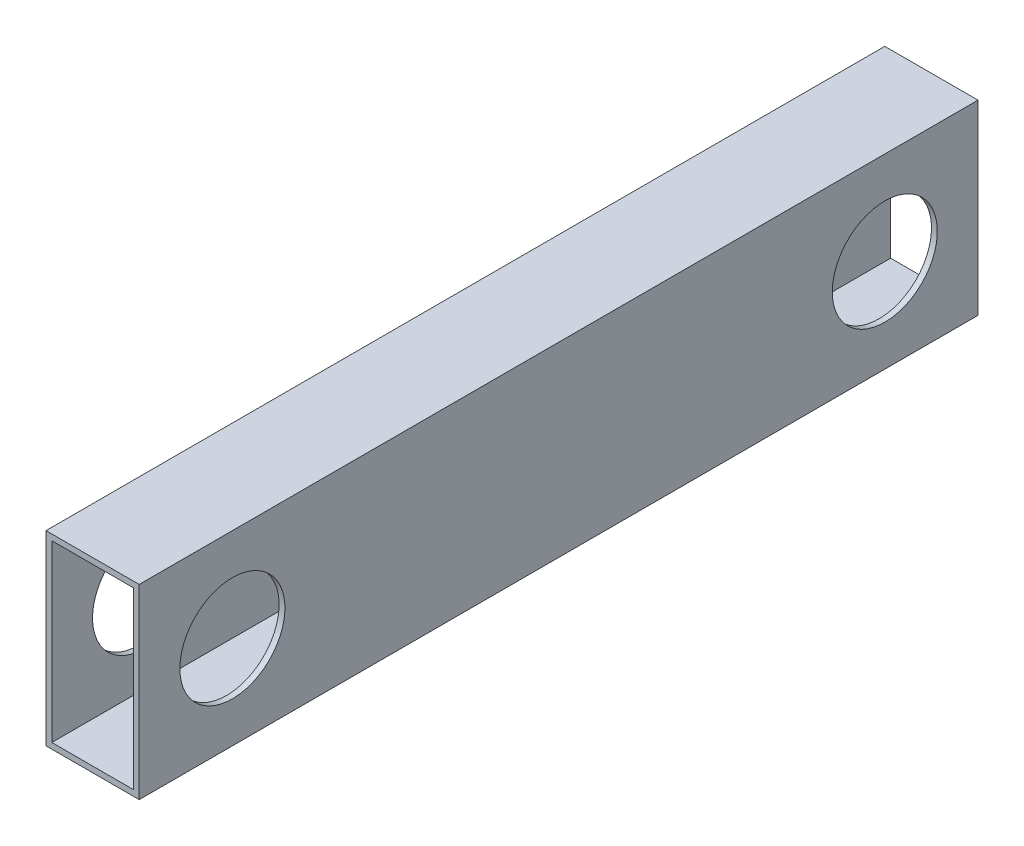
from build123d import *

# Parameters (mm, degrees)
SKETCH1_W               = 25.4
SKETCH1_H               = 50.8
SKETCH1_W_2             = 22.225
SKETCH1_H_2             = 47.625
BOSS_EXTRUDE1_DEPTH     = 228.6
CUT_EXTRUDE1_DEPTH      = 236.549909786
CUT_EXTRUDE1_DEPTH_BACK = 236.549909786
SKETCH2_R               = 14.3129


with BuildPart() as part:
    # Sketch1 → Boss-Extrude1 (new body)
    with BuildSketch(Plane.XY):
        with Locations((12.7, 25.4)):
            Rectangle(SKETCH1_W, SKETCH1_H)
        with Locations((12.7, 25.4)):
            Rectangle(SKETCH1_W_2, SKETCH1_H_2, mode=Mode.SUBTRACT)
    extrude(amount=BOSS_EXTRUDE1_DEPTH)

    # Sketch2 → Cut-Extrude1 (cut, two sides: drawn at the far end of the back side and taken through both)
    with BuildSketch(Plane(origin=(25.4, 0, 0), x_dir=(0, 0, -1), z_dir=(1, 0, 0)).offset(-CUT_EXTRUDE1_DEPTH_BACK)):
        with Locations((-25.4, 25.4)):
            Circle(SKETCH2_R)
        with Locations((-203.2, 25.4)):
            Circle(SKETCH2_R)
    extrude(amount=CUT_EXTRUDE1_DEPTH + CUT_EXTRUDE1_DEPTH_BACK, mode=Mode.SUBTRACT)


solid = part.part
